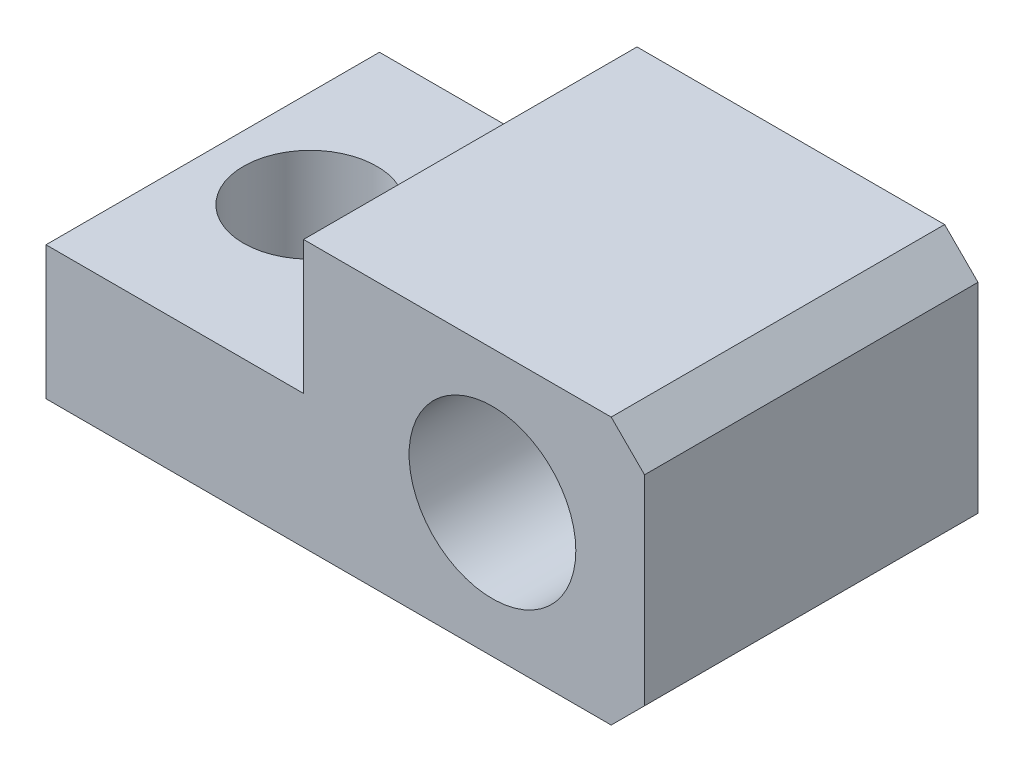
from build123d import *

# Parameters (mm, degrees)
SKETCH_1_R          = 2.5
EXTRUDE_1_DEPTH     = 10
SKETCH_2_R          = 2
CUT_EXTRUDE_2_DEPTH = 18.18324903


with BuildPart() as part:
    # Эскиз1 → Вытянуть1 (new body)
    with BuildSketch(Plane.XY):
        Polygon((3.560836522, 4), (4.560836522, 3), (4.560836522, -3), (3.560836522, -4), (-13.388952432, -4), (-13.388952432, 0), (-5.665361164, 0), (-5.665361164, 4), align=None)
        Circle(SKETCH_1_R, mode=Mode.SUBTRACT)
    extrude(amount=EXTRUDE_1_DEPTH)

    # Эскиз2 → Вытянуть2 (cut, through all)
    with BuildSketch(Plane(origin=(0, 0, 0), x_dir=(-1, 0, 0), z_dir=(0, 1, 0))):
        with Locations((10.466786093, 5)):
            Circle(SKETCH_2_R)
    extrude(amount=-CUT_EXTRUDE_2_DEPTH, mode=Mode.SUBTRACT)


solid = part.part
